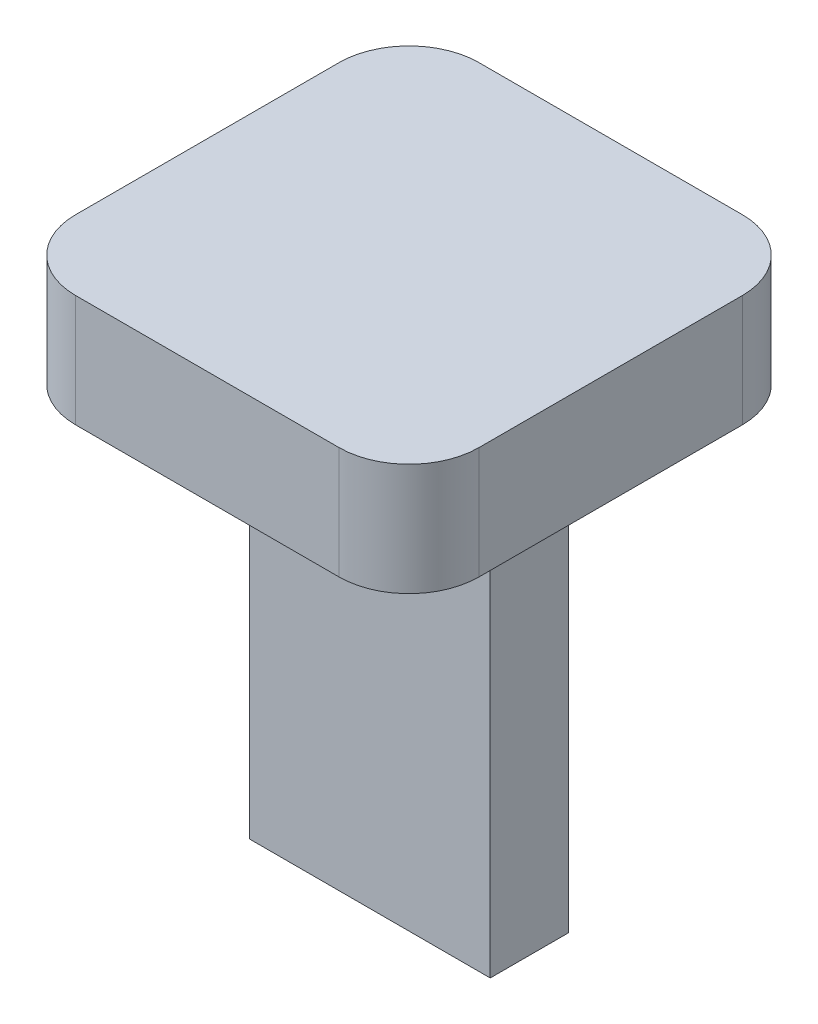
from build123d import *

# Parameters (mm, degrees)
SKETCH1_W           = 4.3
SKETCH1_H           = 1.399999994
BOSS_EXTRUDE1_DEPTH = 7.75
SKETCH2_W           = 7.2
SKETCH2_H           = 7.2
BOSS_EXTRUDE2_DEPTH = 2
FILLET1_R           = 1.25


with BuildPart() as part:
    # Sketch1 → Boss-Extrude1 (new body)
    with BuildSketch(Plane(origin=(0, 0, 0), x_dir=(1, 0, 0), z_dir=(0, 1, 0))):
        Rectangle(SKETCH1_W, SKETCH1_H)
    extrude(amount=BOSS_EXTRUDE1_DEPTH)

    # Sketch2 → Boss-Extrude2 (add)
    with BuildSketch(Plane(origin=(0, 7.75, 0), x_dir=(1, 0, 0), z_dir=(0, 1, 0))):
        Rectangle(SKETCH2_W, SKETCH2_H)
    extrude(amount=BOSS_EXTRUDE2_DEPTH)

    # Fillet1
    fillet1_edges = [part.edges().sort_by_distance(p)[0] for p in [
        (2.15, 7.75, 0),
        (0, 7.75, -0.699999997),
        (-2.15, 7.75, 0),
        (0, 7.75, 0.699999997),
        (3.6, 8.75, -3.6),
        (3.6, 8.75, 3.6),
        (-3.6, 8.75, 3.6),
        (-3.6, 8.75, -3.6),
    ]]
    fillet(fillet1_edges, radius=FILLET1_R)


solid = part.part
